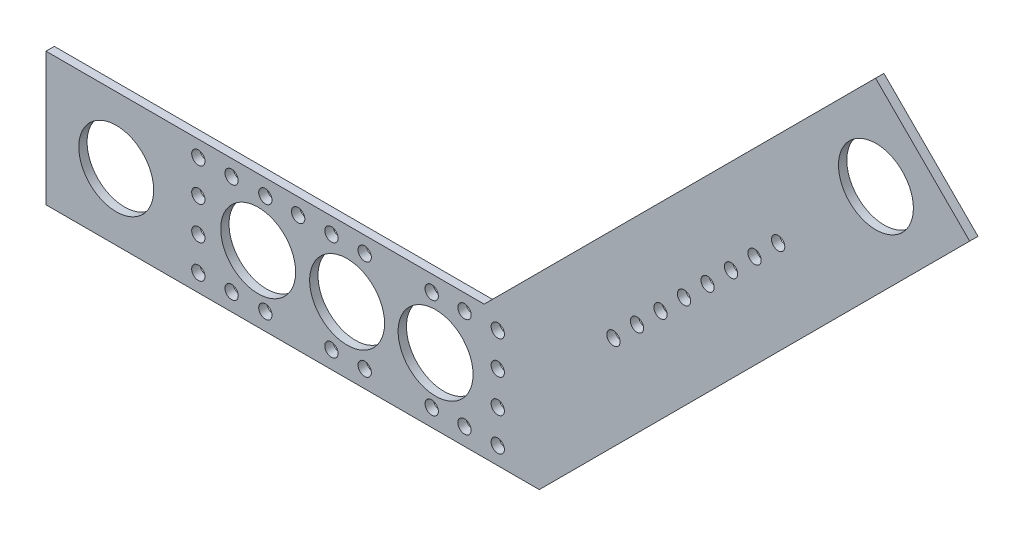
from build123d import *

# Parameters (mm, degrees)
SKETCH1_R           = 2.54
SKETCH1_R_2         = 14.3002
BOSS_EXTRUDE1_DEPTH = 3.175


with BuildPart() as part:
    # Sketch1 → Boss-Extrude1 (new body)
    with BuildSketch(Plane.XY):
        Polygon((-59.693768546, 4.271271353), (-59.693768546, -46.528728647), (128.614138554, -46.528728647), (292.911431822, 117.768564621), (256.990407338, 153.689589105), (107.572089586, 4.271271353), align=None)
        with Locations((11.158871814, -1.812116048)):
            Circle(SKETCH1_R, mode=Mode.SUBTRACT)
        with Locations((24.040159799, -1.812116048)):
            Circle(SKETCH1_R, mode=Mode.SUBTRACT)
        with Locations((36.558871814, -1.812116048)):
            Circle(SKETCH1_R, mode=Mode.SUBTRACT)
        with Locations((49.258871814, -1.812116048)):
            Circle(SKETCH1_R, mode=Mode.SUBTRACT)
        with Locations((61.958871814, -1.812116048)):
            Circle(SKETCH1_R, mode=Mode.SUBTRACT)
        with Locations((87.540159799, -1.812116048)):
            Circle(SKETCH1_R, mode=Mode.SUBTRACT)
        with Locations((100.058871814, -1.812116048)):
            Circle(SKETCH1_R, mode=Mode.SUBTRACT)
        with Locations((112.758871814, -1.812116048)):
            Circle(SKETCH1_R, mode=Mode.SUBTRACT)
        with Locations((112.758871814, -14.512116048)):
            Circle(SKETCH1_R, mode=Mode.SUBTRACT)
        with Locations((112.758871814, -27.212116048)):
            Circle(SKETCH1_R, mode=Mode.SUBTRACT)
        with Locations((112.758871814, -39.912116048)):
            Circle(SKETCH1_R, mode=Mode.SUBTRACT)
        with Locations((100.058871814, -39.912116048)):
            Circle(SKETCH1_R, mode=Mode.SUBTRACT)
        with Locations((87.540159799, -39.912116048)):
            Circle(SKETCH1_R, mode=Mode.SUBTRACT)
        with Locations((61.958871814, -39.912116048)):
            Circle(SKETCH1_R, mode=Mode.SUBTRACT)
        with Locations((49.258871814, -39.912116048)):
            Circle(SKETCH1_R, mode=Mode.SUBTRACT)
        with Locations((24.040159799, -39.912116048)):
            Circle(SKETCH1_R, mode=Mode.SUBTRACT)
        with Locations((11.158871814, -39.912116048)):
            Circle(SKETCH1_R, mode=Mode.SUBTRACT)
        with Locations((-1.541128186, -39.912116048)):
            Circle(SKETCH1_R, mode=Mode.SUBTRACT)
        with Locations((-1.541128186, -27.212116048)):
            Circle(SKETCH1_R, mode=Mode.SUBTRACT)
        with Locations((-1.541128186, -14.512116048)):
            Circle(SKETCH1_R, mode=Mode.SUBTRACT)
        with Locations((-1.541128186, -1.812116048)):
            Circle(SKETCH1_R, mode=Mode.SUBTRACT)
        with Locations((55.2538213, -21.128728647)):
            Circle(SKETCH1_R_2, mode=Mode.SUBTRACT)
        with Locations((-32.8841787, -21.128728647)):
            Circle(SKETCH1_R_2, mode=Mode.SUBTRACT)
        with Locations((257.120708411, 117.898865694)):
            Circle(SKETCH1_R_2, mode=Mode.SUBTRACT)
        with Locations((21.301280743, -21.128728647)):
            Circle(SKETCH1_R_2, mode=Mode.SUBTRACT)
        with Locations((89.0240103, -21.128728647)):
            Circle(SKETCH1_R_2, mode=Mode.SUBTRACT)
        with Locations((156.927029711, 17.705186994)):
            Circle(SKETCH1_R, mode=Mode.SUBTRACT)
        with Locations((165.907285832, 26.685443115)):
            Circle(SKETCH1_R, mode=Mode.SUBTRACT)
        with Locations((174.887541953, 35.665699236)):
            Circle(SKETCH1_R, mode=Mode.SUBTRACT)
        with Locations((183.867798074, 44.645955357)):
            Circle(SKETCH1_R, mode=Mode.SUBTRACT)
        with Locations((192.848054195, 53.626211478)):
            Circle(SKETCH1_R, mode=Mode.SUBTRACT)
        with Locations((201.828310316, 62.606467599)):
            Circle(SKETCH1_R, mode=Mode.SUBTRACT)
        with Locations((210.808566437, 71.58672372)):
            Circle(SKETCH1_R, mode=Mode.SUBTRACT)
        with Locations((219.788822558, 80.566979841)):
            Circle(SKETCH1_R, mode=Mode.SUBTRACT)
    extrude(amount=BOSS_EXTRUDE1_DEPTH)


solid = part.part
